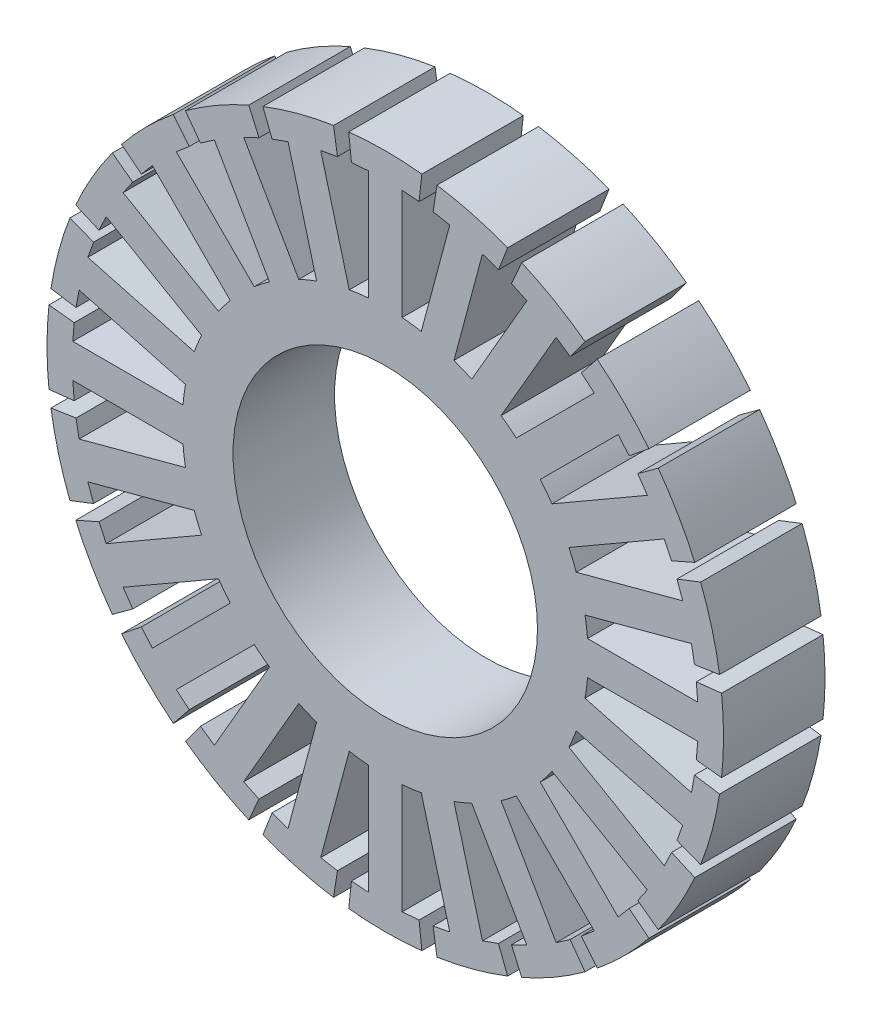
from build123d import *

# Parameters (mm, degrees)
SKETCH1_R           = 9
BOSS_EXTRUDE1_DEPTH = 6


with BuildPart() as part:
    # Sketch1 → Boss-Extrude1 (new body)
    with BuildSketch(Plane.XY):
        with BuildLine():
            Line((-1, 18.472953202), (-1, 11.958260743))
            ThreePointArc((-1, 11.958260743), (-1.566314307, 11.897338336), (-2.1290998, 11.809611934))
            Line((-2.1290998, 11.809611934), (-3.815226282, 18.102321631))
            Line((-3.815226282, 18.102321631), (-2.828238009, 18.282534555))
            Line((-2.828238009, 18.282534555), (-3.057554604, 19.764902222))
            ThreePointArc((-3.057554604, 19.764902222), (-5.176380902, 19.318516526), (-7.23453115, 18.64568473))
            Line((-7.23453115, 18.64568473), (-6.691941314, 17.247258375))
            Line((-6.691941314, 17.247258375), (-5.747077934, 17.58468354))
            Line((-5.747077934, 17.58468354), (-4.060951453, 11.291973844))
            ThreePointArc((-4.060951453, 11.291973844), (-4.592201188, 11.08655439), (-5.113104968, 10.856157589))
            Line((-5.113104968, 10.856157589), (-8.370451197, 16.498046756))
            Line((-8.370451197, 16.498046756), (-7.463736271, 16.927570436))
            Line((-7.463736271, 16.927570436), (-8.068904077, 18.300076147))
            ThreePointArc((-8.068904077, 18.300076147), (-10, 17.320508076), (-11.813878796, 16.137913985))
            Line((-11.813878796, 16.137913985), (-10.927837886, 14.927570436))
            Line((-10.927837886, 14.927570436), (-10.102502005, 15.498046756))
            Line((-10.102502005, 15.498046756), (-6.845155775, 9.856157589))
            ThreePointArc((-6.845155775, 9.856157589), (-7.305137148, 9.520240083), (-7.748660481, 9.162874044))
            Line((-7.748660481, 9.162874044), (-12.355243696, 13.769457259))
            Line((-12.355243696, 13.769457259), (-11.590593241, 14.419020366))
            Line((-11.590593241, 14.419020366), (-12.530371072, 15.588130125))
            ThreePointArc((-12.530371072, 15.588130125), (-14.142135624, 14.142135624), (-15.588130125, 12.530371072))
            Line((-15.588130125, 12.530371072), (-14.419020366, 11.590593241))
            Line((-14.419020366, 11.590593241), (-13.769457259, 12.355243696))
            Line((-13.769457259, 12.355243696), (-9.162874044, 7.748660481))
            ThreePointArc((-9.162874044, 7.748660481), (-9.520240083, 7.305137148), (-9.856157589, 6.845155775))
            Line((-9.856157589, 6.845155775), (-15.498046756, 10.102502005))
            Line((-15.498046756, 10.102502005), (-14.927570436, 10.927837886))
            Line((-14.927570436, 10.927837886), (-16.137913985, 11.813878796))
            ThreePointArc((-16.137913985, 11.813878796), (-17.320508076, 10), (-18.300076147, 8.068904077))
            Line((-18.300076147, 8.068904077), (-16.927570436, 7.463736271))
            Line((-16.927570436, 7.463736271), (-16.498046756, 8.370451197))
            Line((-16.498046756, 8.370451197), (-10.856157589, 5.113104968))
            ThreePointArc((-10.856157589, 5.113104968), (-11.08655439, 4.592201188), (-11.291973844, 4.060951453))
            Line((-11.291973844, 4.060951453), (-17.58468354, 5.747077934))
            Line((-17.58468354, 5.747077934), (-17.247258375, 6.691941314))
            Line((-17.247258375, 6.691941314), (-18.64568473, 7.23453115))
            ThreePointArc((-18.64568473, 7.23453115), (-19.318516526, 5.176380902), (-19.764902222, 3.057554604))
            Line((-19.764902222, 3.057554604), (-18.282534555, 2.828238009))
            Line((-18.282534555, 2.828238009), (-18.102321631, 3.815226282))
            Line((-18.102321631, 3.815226282), (-11.809611934, 2.1290998))
            ThreePointArc((-11.809611934, 2.1290998), (-11.897338336, 1.566314307), (-11.958260743, 1))
            Line((-11.958260743, 1), (-18.472953202, 1))
            Line((-18.472953202, 1), (-18.391574158, 2))
            Line((-18.391574158, 2), (-19.882782873, 2.162162162))
            ThreePointArc((-19.882782873, 2.162162162), (-20, 0), (-19.882782873, -2.162162162))
            Line((-19.882782873, -2.162162162), (-18.391574158, -2))
            Line((-18.391574158, -2), (-18.472953202, -1))
            Line((-18.472953202, -1), (-11.958260743, -1))
            ThreePointArc((-11.958260743, -1), (-11.897338336, -1.566314307), (-11.809611934, -2.1290998))
            Line((-11.809611934, -2.1290998), (-18.102321631, -3.815226282))
            Line((-18.102321631, -3.815226282), (-18.282534555, -2.828238009))
            Line((-18.282534555, -2.828238009), (-19.764902222, -3.057554604))
            ThreePointArc((-19.764902222, -3.057554604), (-19.318516526, -5.176380902), (-18.64568473, -7.23453115))
            Line((-18.64568473, -7.23453115), (-17.247258375, -6.691941314))
            Line((-17.247258375, -6.691941314), (-17.58468354, -5.747077934))
            Line((-17.58468354, -5.747077934), (-11.291973844, -4.060951453))
            ThreePointArc((-11.291973844, -4.060951453), (-11.08655439, -4.592201188), (-10.856157589, -5.113104968))
            Line((-10.856157589, -5.113104968), (-16.498046756, -8.370451197))
            Line((-16.498046756, -8.370451197), (-16.927570436, -7.463736271))
            Line((-16.927570436, -7.463736271), (-18.300076147, -8.068904077))
            ThreePointArc((-18.300076147, -8.068904077), (-17.320508076, -10), (-16.137913985, -11.813878796))
            Line((-16.137913985, -11.813878796), (-14.927570436, -10.927837886))
            Line((-14.927570436, -10.927837886), (-15.498046756, -10.102502005))
            Line((-15.498046756, -10.102502005), (-9.856157589, -6.845155775))
            ThreePointArc((-9.856157589, -6.845155775), (-9.520240083, -7.305137148), (-9.162874044, -7.748660481))
            Line((-9.162874044, -7.748660481), (-13.769457259, -12.355243696))
            Line((-13.769457259, -12.355243696), (-14.419020366, -11.590593241))
            Line((-14.419020366, -11.590593241), (-15.588130125, -12.530371072))
            ThreePointArc((-15.588130125, -12.530371072), (-14.142135624, -14.142135624), (-12.530371072, -15.588130125))
            Line((-12.530371072, -15.588130125), (-11.590593241, -14.419020366))
            Line((-11.590593241, -14.419020366), (-12.355243696, -13.769457259))
            Line((-12.355243696, -13.769457259), (-7.748660481, -9.162874044))
            ThreePointArc((-7.748660481, -9.162874044), (-7.305137148, -9.520240083), (-6.845155775, -9.856157589))
            Line((-6.845155775, -9.856157589), (-10.102502005, -15.498046756))
            Line((-10.102502005, -15.498046756), (-10.927837886, -14.927570436))
            Line((-10.927837886, -14.927570436), (-11.813878796, -16.137913985))
            ThreePointArc((-11.813878796, -16.137913985), (-10, -17.320508076), (-8.068904077, -18.300076147))
            Line((-8.068904077, -18.300076147), (-7.463736271, -16.927570436))
            Line((-7.463736271, -16.927570436), (-8.370451197, -16.498046756))
            Line((-8.370451197, -16.498046756), (-5.113104968, -10.856157589))
            ThreePointArc((-5.113104968, -10.856157589), (-4.592201188, -11.08655439), (-4.060951453, -11.291973844))
            Line((-4.060951453, -11.291973844), (-5.747077934, -17.58468354))
            Line((-5.747077934, -17.58468354), (-6.691941314, -17.247258375))
            Line((-6.691941314, -17.247258375), (-7.23453115, -18.64568473))
            ThreePointArc((-7.23453115, -18.64568473), (-5.176380902, -19.318516526), (-3.057554604, -19.764902222))
            Line((-3.057554604, -19.764902222), (-2.828238009, -18.282534555))
            Line((-2.828238009, -18.282534555), (-3.815226282, -18.102321631))
            Line((-3.815226282, -18.102321631), (-2.1290998, -11.809611934))
            ThreePointArc((-2.1290998, -11.809611934), (-1.566314307, -11.897338336), (-1, -11.958260743))
            Line((-1, -11.958260743), (-1, -18.472953202))
            Line((-1, -18.472953202), (-2, -18.391574158))
            Line((-2, -18.391574158), (-2.162162162, -19.882782873))
            ThreePointArc((-2.162162162, -19.882782873), (0, -20), (2.162162162, -19.882782873))
            Line((2.162162162, -19.882782873), (2, -18.391574158))
            Line((2, -18.391574158), (1, -18.472953202))
            Line((1, -18.472953202), (1, -11.958260743))
            ThreePointArc((1, -11.958260743), (1.566314307, -11.897338336), (2.1290998, -11.809611934))
            Line((2.1290998, -11.809611934), (3.815226282, -18.102321631))
            Line((3.815226282, -18.102321631), (2.828238009, -18.282534555))
            Line((2.828238009, -18.282534555), (3.057554604, -19.764902222))
            ThreePointArc((3.057554604, -19.764902222), (5.176380902, -19.318516526), (7.23453115, -18.64568473))
            Line((7.23453115, -18.64568473), (6.691941314, -17.247258375))
            Line((6.691941314, -17.247258375), (5.747077934, -17.58468354))
            Line((5.747077934, -17.58468354), (4.060951453, -11.291973844))
            ThreePointArc((4.060951453, -11.291973844), (4.592201188, -11.08655439), (5.113104968, -10.856157589))
            Line((5.113104968, -10.856157589), (8.370451197, -16.498046756))
            Line((8.370451197, -16.498046756), (7.463736271, -16.927570436))
            Line((7.463736271, -16.927570436), (8.068904077, -18.300076147))
            ThreePointArc((8.068904077, -18.300076147), (10, -17.320508076), (11.813878796, -16.137913985))
            Line((11.813878796, -16.137913985), (10.927837886, -14.927570436))
            Line((10.927837886, -14.927570436), (10.102502005, -15.498046756))
            Line((10.102502005, -15.498046756), (6.845155775, -9.856157589))
            ThreePointArc((6.845155775, -9.856157589), (7.305137148, -9.520240083), (7.748660481, -9.162874044))
            Line((7.748660481, -9.162874044), (12.355243696, -13.769457259))
            Line((12.355243696, -13.769457259), (11.590593241, -14.419020366))
            Line((11.590593241, -14.419020366), (12.530371072, -15.588130125))
            ThreePointArc((12.530371072, -15.588130125), (14.142135624, -14.142135624), (15.588130125, -12.530371072))
            Line((15.588130125, -12.530371072), (14.419020366, -11.590593241))
            Line((14.419020366, -11.590593241), (13.769457259, -12.355243696))
            Line((13.769457259, -12.355243696), (9.162874044, -7.748660481))
            ThreePointArc((9.162874044, -7.748660481), (9.520240083, -7.305137148), (9.856157589, -6.845155775))
            Line((9.856157589, -6.845155775), (15.498046756, -10.102502005))
            Line((15.498046756, -10.102502005), (14.927570436, -10.927837886))
            Line((14.927570436, -10.927837886), (16.137913985, -11.813878796))
            ThreePointArc((16.137913985, -11.813878796), (17.320508076, -10), (18.300076147, -8.068904077))
            Line((18.300076147, -8.068904077), (16.927570436, -7.463736271))
            Line((16.927570436, -7.463736271), (16.498046756, -8.370451197))
            Line((16.498046756, -8.370451197), (10.856157589, -5.113104968))
            ThreePointArc((10.856157589, -5.113104968), (11.08655439, -4.592201188), (11.291973844, -4.060951453))
            Line((11.291973844, -4.060951453), (17.58468354, -5.747077934))
            Line((17.58468354, -5.747077934), (17.247258375, -6.691941314))
            Line((17.247258375, -6.691941314), (18.64568473, -7.23453115))
            ThreePointArc((18.64568473, -7.23453115), (19.318516526, -5.176380902), (19.764902222, -3.057554604))
            Line((19.764902222, -3.057554604), (18.282534555, -2.828238009))
            Line((18.282534555, -2.828238009), (18.102321631, -3.815226282))
            Line((18.102321631, -3.815226282), (11.809611934, -2.1290998))
            ThreePointArc((11.809611934, -2.1290998), (11.897338336, -1.566314307), (11.958260743, -1))
            Line((11.958260743, -1), (18.472953202, -1))
            Line((18.472953202, -1), (18.391574158, -2))
            Line((18.391574158, -2), (19.882782873, -2.162162162))
            ThreePointArc((19.882782873, -2.162162162), (20, 0), (19.882782873, 2.162162162))
            Line((19.882782873, 2.162162162), (18.391574158, 2))
            Line((18.391574158, 2), (18.472953202, 1))
            Line((18.472953202, 1), (11.958260743, 1))
            ThreePointArc((11.958260743, 1), (11.897338336, 1.566314307), (11.809611934, 2.1290998))
            Line((11.809611934, 2.1290998), (18.102321631, 3.815226282))
            Line((18.102321631, 3.815226282), (18.282534555, 2.828238009))
            Line((18.282534555, 2.828238009), (19.764902222, 3.057554604))
            ThreePointArc((19.764902222, 3.057554604), (19.318516526, 5.176380902), (18.64568473, 7.23453115))
            Line((18.64568473, 7.23453115), (17.247258375, 6.691941314))
            Line((17.247258375, 6.691941314), (17.58468354, 5.747077934))
            Line((17.58468354, 5.747077934), (11.291973844, 4.060951453))
            ThreePointArc((11.291973844, 4.060951453), (11.08655439, 4.592201188), (10.856157589, 5.113104968))
            Line((10.856157589, 5.113104968), (16.498046756, 8.370451197))
            Line((16.498046756, 8.370451197), (16.927570436, 7.463736271))
            Line((16.927570436, 7.463736271), (18.300076147, 8.068904077))
            ThreePointArc((18.300076147, 8.068904077), (17.320508076, 10), (16.137913985, 11.813878796))
            Line((16.137913985, 11.813878796), (14.927570436, 10.927837886))
            Line((14.927570436, 10.927837886), (15.498046756, 10.102502005))
            Line((15.498046756, 10.102502005), (9.856157589, 6.845155775))
            ThreePointArc((9.856157589, 6.845155775), (9.520240083, 7.305137148), (9.162874044, 7.748660481))
            Line((9.162874044, 7.748660481), (13.769457259, 12.355243696))
            Line((13.769457259, 12.355243696), (14.419020366, 11.590593241))
            Line((14.419020366, 11.590593241), (15.588130125, 12.530371072))
            ThreePointArc((15.588130125, 12.530371072), (14.142135624, 14.142135624), (12.530371072, 15.588130125))
            Line((12.530371072, 15.588130125), (11.590593241, 14.419020366))
            Line((11.590593241, 14.419020366), (12.355243696, 13.769457259))
            Line((12.355243696, 13.769457259), (7.748660481, 9.162874044))
            ThreePointArc((7.748660481, 9.162874044), (7.305137148, 9.520240083), (6.845155775, 9.856157589))
            Line((6.845155775, 9.856157589), (10.102502005, 15.498046756))
            Line((10.102502005, 15.498046756), (10.927837886, 14.927570436))
            Line((10.927837886, 14.927570436), (11.813878796, 16.137913985))
            ThreePointArc((11.813878796, 16.137913985), (10, 17.320508076), (8.068904077, 18.300076147))
            Line((8.068904077, 18.300076147), (7.463736271, 16.927570436))
            Line((7.463736271, 16.927570436), (8.370451197, 16.498046756))
            Line((8.370451197, 16.498046756), (5.113104968, 10.856157589))
            ThreePointArc((5.113104968, 10.856157589), (4.592201188, 11.08655439), (4.060951453, 11.291973844))
            Line((4.060951453, 11.291973844), (5.747077934, 17.58468354))
            Line((5.747077934, 17.58468354), (6.691941314, 17.247258375))
            Line((6.691941314, 17.247258375), (7.23453115, 18.64568473))
            ThreePointArc((7.23453115, 18.64568473), (5.176380902, 19.318516526), (3.057554604, 19.764902222))
            Line((3.057554604, 19.764902222), (2.828238009, 18.282534555))
            Line((2.828238009, 18.282534555), (3.815226282, 18.102321631))
            Line((3.815226282, 18.102321631), (2.1290998, 11.809611934))
            ThreePointArc((2.1290998, 11.809611934), (1.566314307, 11.897338336), (1, 11.958260743))
            Line((1, 11.958260743), (1, 18.472953202))
            Line((1, 18.472953202), (2, 18.391574158))
            Line((2, 18.391574158), (2.162162162, 19.882782873))
            ThreePointArc((2.162162162, 19.882782873), (0, 20), (-2.162162162, 19.882782873))
            Line((-2.162162162, 19.882782873), (-2, 18.391574158))
            Line((-2, 18.391574158), (-1, 18.472953202))
        make_face()
        Circle(SKETCH1_R, mode=Mode.SUBTRACT)
    extrude(amount=BOSS_EXTRUDE1_DEPTH)


solid = part.part
